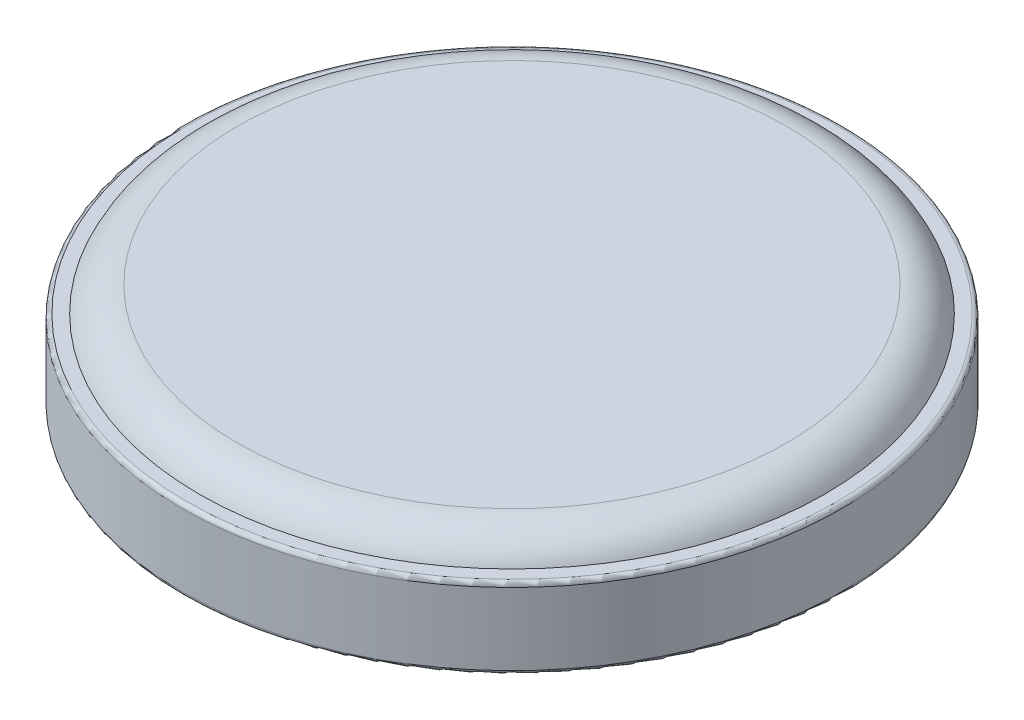
from build123d import *

# Parameters (mm, degrees)
SKETCH1_R           = 10
BOSS_EXTRUDE1_DEPTH = 3.2
CUT_EXTRUDE1_START  = -0.762
SKETCH2_R           = 10
SKETCH2_R_2         = 9.492
CUT_EXTRUDE1_DEPTH  = 0.762
FILLET3_R           = 1.27
FILLET2_R           = 0.127


with BuildPart() as part:
    # Sketch1 → Boss-Extrude1 (new body)
    with BuildSketch(Plane(origin=(0, 0, 0), x_dir=(1, 0, 0), z_dir=(0, 1, 0))):
        with Locations(Location((0, 0, 0), (0, 0, 270))):
            Circle(SKETCH1_R)
    extrude(amount=BOSS_EXTRUDE1_DEPTH)

    # Sketch2 → Cut-Extrude1 (cut)
    with BuildSketch(Plane(origin=(0, 3.2, 0), x_dir=(1, 0, 0), z_dir=(0, 1, 0)).offset(CUT_EXTRUDE1_START)):
        with Locations(Location((0, 0, 0), (0, 0, 270))):
            Circle(SKETCH2_R)
        with Locations(Location((0, 0, 0), (0, 0, 270))):
            Circle(SKETCH2_R_2, mode=Mode.SUBTRACT)
    extrude(amount=CUT_EXTRUDE1_DEPTH, mode=Mode.SUBTRACT)

    # Fillet3
    # the kernel refuses this fillet: 1.27 mm, written as the material it takes off along each edge
    with BuildSketch(Plane(origin=(0, 3.2, 0), x_dir=(0, 0, 1), z_dir=(-1, 0, 0))) as fillet3_piece_1:
        with BuildLine():
            CenterArc((8.328025773, -1.27), FILLET3_R, 23.578178478, 66.421821522)
            Line((8.328025773, 0), (8.328025773, 0.0254))
            Line((8.328025773, 0.0254), (9.492, 0.0254))
            Line((9.492, 0.0254), (9.5174, 0))
            ThreePointArc((9.5174, 0), (9.5174, -0.381), (9.515279485, -0.75184))
            Line((9.515279485, -0.75184), (9.492, -0.762))
        make_face()
    revolve(axis=Axis((0, 3.2, 0), (0, 1, 0)), mode=Mode.SUBTRACT)

    # Fillet2
    fillet2_edges = [part.edges().sort_by_distance(p)[0] for p in [
        (0, 0, -10),
        (0, 2.438, -10),
    ]]
    fillet(fillet2_edges, radius=FILLET2_R)


solid = part.part
